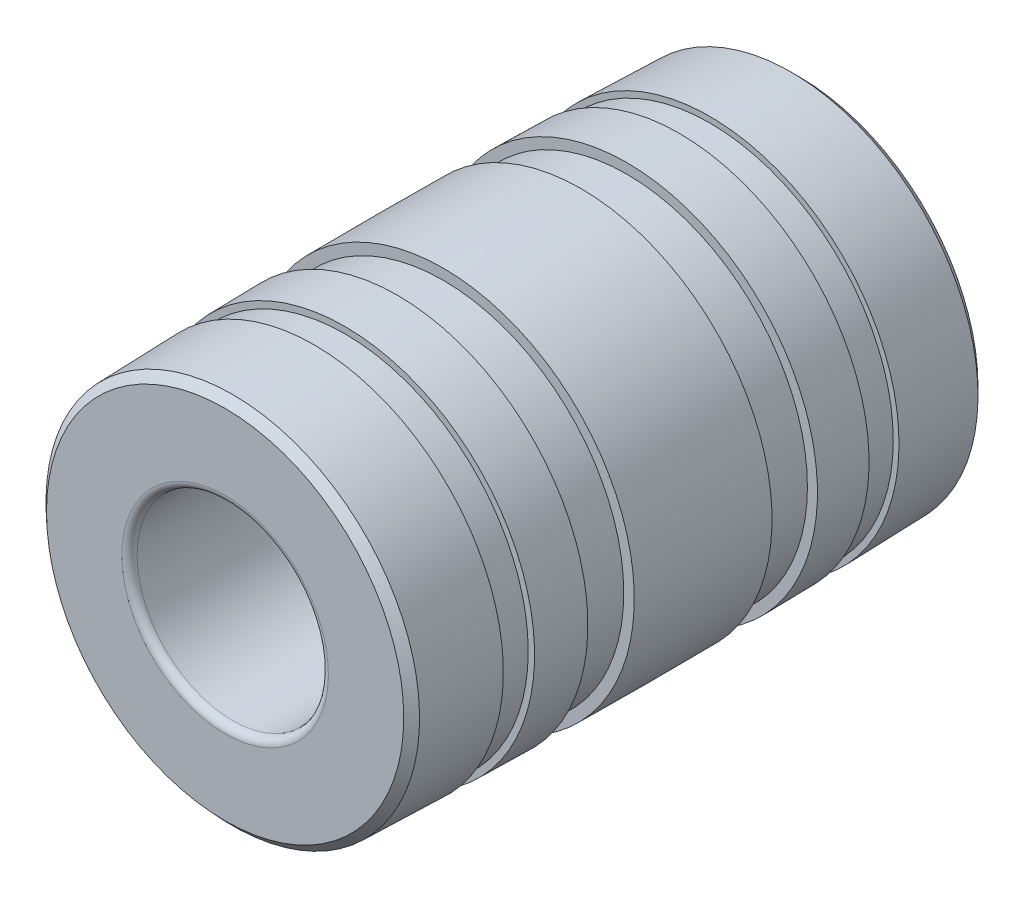
from build123d import *
from OCP.BRepFilletAPI import BRepFilletAPI_MakeChamfer

# Parameters (mm, degrees)
BORE_DEPTH       = 14.090860531
BORE_DEPTH_BACK  = 14.090860531
SKETCH2_R        = 3.175
OD_CHAMFER_SIZE  = 0.254
OD_CHAMFER_SIZE2 = 0.262907157
ID_FILLET_R      = 0.254


with BuildPart() as part:
    # Sketch1 → Bearing (revolve)
    with BuildSketch(Plane(origin=(0, 0, 0), x_dir=(0, 0, -1), z_dir=(1, 0, 0))):
        with BuildLine():
            Line((-9.525, 0), (9.525, 0))
            Line((9.525, 0), (9.525, -6.19125))
            ThreePointArc((9.525, -6.19125), (8.045557875, -6.236743921), (6.5659, -6.274576101))
            Line((6.5659, -6.274576101), (6.5659, -6.084076101))
            Line((6.5659, -6.084076101), (5.5499, -6.084076101))
            Line((5.5499, -6.084076101), (5.5499, -6.296114192))
            ThreePointArc((5.5499, -6.296114192), (4.679971682, -6.311684129), (3.81, -6.324605926))
            Line((3.81, -6.324605926), (3.81, -5.991230926))
            Line((3.81, -5.991230926), (2.286, -5.991230926))
            Line((2.286, -5.991230926), (2.286, -6.340858393))
            ThreePointArc((2.286, -6.340858393), (1.143009139, -6.347714589), (0, -6.35))
            ThreePointArc((0, -6.35), (-1.143009139, -6.347714589), (-2.286, -6.340858393))
            Line((-2.286, -6.340858393), (-2.286, -5.991230926))
            Line((-2.286, -5.991230926), (-3.81, -5.991230926))
            Line((-3.81, -5.991230926), (-3.81, -6.324605926))
            ThreePointArc((-3.81, -6.324605926), (-4.679971682, -6.311684129), (-5.5499, -6.296114192))
            Line((-5.5499, -6.296114192), (-5.5499, -6.084076101))
            Line((-5.5499, -6.084076101), (-6.5659, -6.084076101))
            Line((-6.5659, -6.084076101), (-6.5659, -6.274576101))
            ThreePointArc((-6.5659, -6.274576101), (-8.045557875, -6.236743921), (-9.525, -6.19125))
            Line((-9.525, -6.19125), (-9.525, 0))
        make_face()
    revolve(axis=Axis((0, 0, 9.525), (0, 0, -1)))

    # Sketch2 → Bore (cut, two sides: drawn at the far end of the back side and taken through both)
    with BuildSketch(Plane.XY.offset(-BORE_DEPTH_BACK)):
        Circle(SKETCH2_R)
    extrude(amount=BORE_DEPTH + BORE_DEPTH_BACK, mode=Mode.SUBTRACT)

    # OD Chamfer: one chamfer whose edges measure the first distance from different faces: ONE call of the kernel's chamfer builder (chamfer() names one face for all edges)
    od_chamfer_edges_1 = [part.edges().sort_by_distance(p)[0] for p in [
        (0, 6.19125, -9.525),
    ]]
    od_chamfer_side_1 = [part.faces().sort_by_distance(p)[0] for p in [
        (0, 6.016135006, -9.525),
    ]]
    od_chamfer_edges_2 = [part.edges().sort_by_distance(p)[0] for p in [
        (0, 6.19125, 9.525),
    ]]
    od_chamfer_side_2 = [part.faces().sort_by_distance(p)[0] for p in [
        (0, 6.236743921, 8.045557875),
    ]]
    od_chamfer = BRepFilletAPI_MakeChamfer(part.part.solid().wrapped)
    for e in od_chamfer_edges_1:
        od_chamfer.Add(OD_CHAMFER_SIZE, OD_CHAMFER_SIZE2, e.wrapped, od_chamfer_side_1[0].wrapped)  # the first distance lies on this face
    for e in od_chamfer_edges_2:
        od_chamfer.Add(OD_CHAMFER_SIZE, OD_CHAMFER_SIZE2, e.wrapped, od_chamfer_side_2[0].wrapped)  # the first distance lies on this face
    add(Compound.cast(od_chamfer.Shape()), mode=Mode.REPLACE)

    # ID Fillet
    id_fillet_edges = [part.edges().sort_by_distance(p)[0] for p in [
        (-3.175, 0, -9.525),
        (-3.175, 0, 9.525),
    ]]
    fillet(id_fillet_edges, radius=ID_FILLET_R)


solid = part.part
